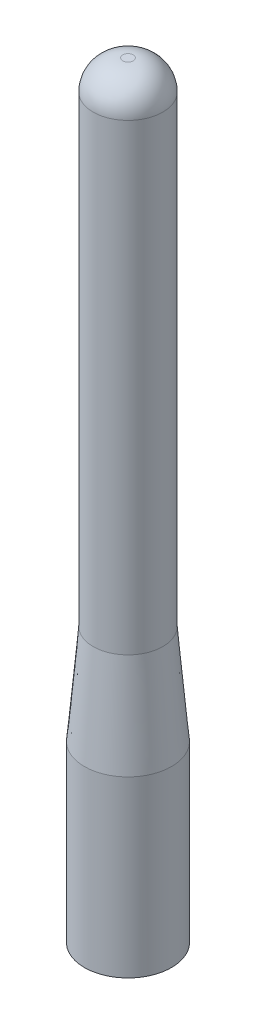
from build123d import *

# Parameters (mm, degrees)
SKETCH1_R           = 5
BOSS_EXTRUDE1_DEPTH = 20
SKETCH2_R           = 4
BOSS_EXTRUDE2_DEPTH = 68
FILLET1_R           = 3.4
CHAMFER1_SIZE       = 11.430052303
CHAMFER1_SIZE_2     = 1
SKETCH3_W           = 5
SKETCH3_H           = 5
CUT_EXTRUDE1_DEPTH  = 8
SKETCH4_W           = 5
SKETCH4_H           = 2.702388579
CUT_EXTRUDE2_DEPTH  = 8
SKETCH5_R           = 0.5
BOSS_EXTRUDE3_DEPTH = 5


with BuildPart() as part:
    # Sketch1 → Boss-Extrude1 (new body)
    with BuildSketch(Plane(origin=(0, 0, 0), x_dir=(1, 0, 0), z_dir=(0, 1, 0))):
        with Locations(Location((0, 0, 0), (0, 0, 270))):
            Circle(SKETCH1_R)
    extrude(amount=BOSS_EXTRUDE1_DEPTH)

    # Sketch2 → Boss-Extrude2 (add)
    with BuildSketch(Plane(origin=(0, 20, 0), x_dir=(1, 0, 0), z_dir=(0, 1, 0))):
        with Locations(Location((0, 0, 0), (0, 0, 270))):
            Circle(SKETCH2_R)
    extrude(amount=BOSS_EXTRUDE2_DEPTH)

    # Fillet1
    fillet1_edges = [part.edges().sort_by_distance(p)[0] for p in [
        (0, 88, -4),
    ]]
    fillet(fillet1_edges, radius=FILLET1_R)

    # Chamfer1
    # the kernel refuses this chamfer: 11.430052303, 1 mm, written as the material it adds along each edge
    with BuildSketch(Plane(origin=(0, 20, 0), x_dir=(0, 0, 1), z_dir=(-1, 0, 0))) as chamfer1_piece_1_section:
        Polygon((4, CHAMFER1_SIZE), (4 + CHAMFER1_SIZE_2, 0), (4, 0), align=None)
    chamfer1_piece_1 = revolve(axis=Axis((0, 20, 0), (0, 1, 0)), mode=Mode.PRIVATE)
    chamfer1_piece_1 = chamfer1_piece_1 & Plane(origin=(0, 25.937398898, 0), x_dir=(0, 0, 1), z_dir=(0, -1, 0)) * Cylinder(5, 46, mode=Mode.PRIVATE)
    add(chamfer1_piece_1)

    # Sketch3 → Cut-Extrude1 (cut)
    with BuildSketch(Plane(origin=(0, 0, 0), x_dir=(-1, 0, 0), z_dir=(0, -1, 0))):
        Rectangle(SKETCH3_W, SKETCH3_H)
    extrude(amount=-CUT_EXTRUDE1_DEPTH, mode=Mode.SUBTRACT)

    # Sketch4 → Cut-Extrude2 (cut)
    with BuildSketch(Plane(origin=(0, 0, 0), x_dir=(-1, 0, 0), z_dir=(0, -1, 0))):
        with Locations((0, 3.851194289)):
            Rectangle(SKETCH4_W, SKETCH4_H)
    extrude(amount=-CUT_EXTRUDE2_DEPTH, mode=Mode.SUBTRACT)

    # Sketch5 → Boss-Extrude3 (add)
    with BuildSketch(Plane.ZY.offset(-2.5)):
        with Locations(Location((0, 5.5, 0), (0, 0, 180))):
            Circle(SKETCH5_R)
    extrude(amount=BOSS_EXTRUDE3_DEPTH)


solid = part.part
